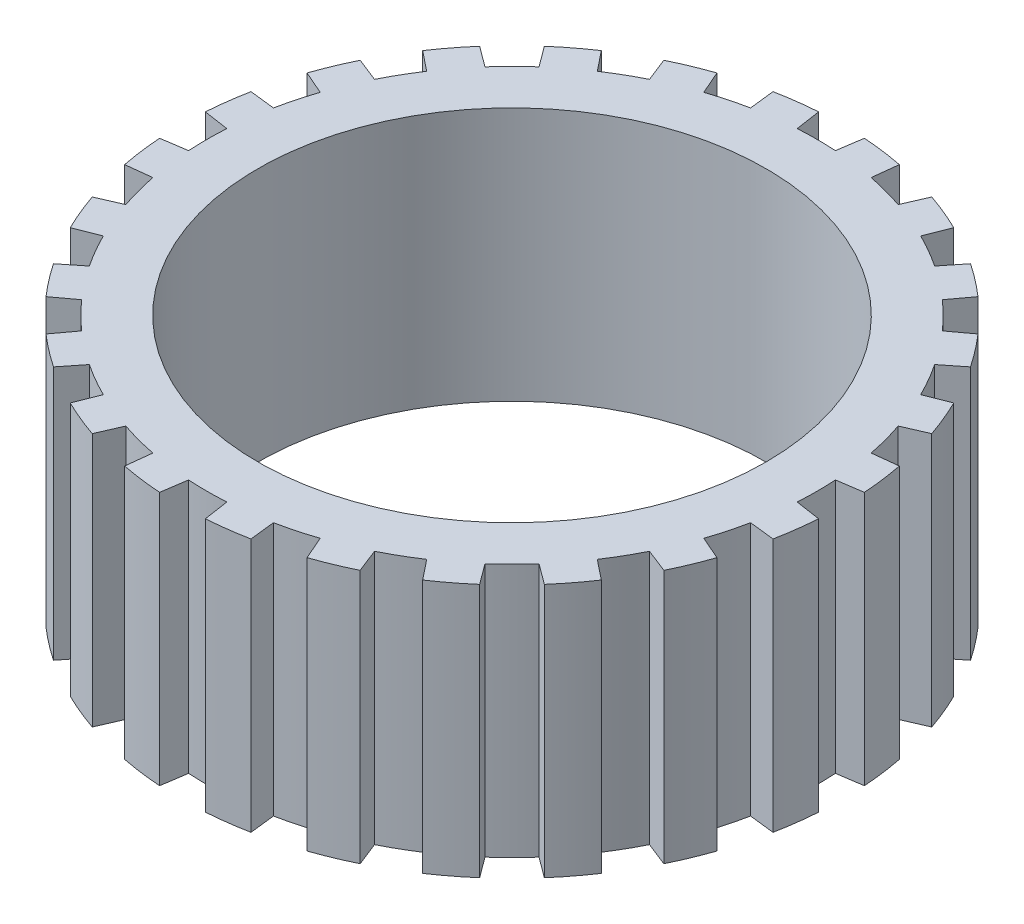
from build123d import *

# Parameters (mm, degrees)
SKETCH2_W           = 10
SKETCH2_H           = 50
BOSS_EXTRUDE1_START = 50
BOSS_EXTRUDE1_DEPTH = 50


with BuildPart() as part:
    # Sketch2 → Revolve1 (revolve)
    with BuildSketch(Plane.XY):
        with Locations((55, 25)):
            Rectangle(SKETCH2_W, SKETCH2_H)
    revolve(axis=Axis((0, -1000, 0), (0, 1, 0)))

    # Sketch3 → Boss-Extrude1 (add)
    with BuildSketch(Plane(origin=(0, 0, 0), x_dir=(1, 0, 0), z_dir=(0, 1, 0)).offset(BOSS_EXTRUDE1_START)):
        with BuildLine():
            Line((4.502343049, 64.84388103), (3.76078814, 59.88202128))
            ThreePointArc((3.76078814, 59.88202128), (7.831571533, 59.486691682), (11.865965175, 58.81495448))
            Line((11.865965175, 58.81495448), (12.43390194, 63.799671493))
            ThreePointArc((12.43390194, 63.799671493), (8.484202494, 64.443915989), (4.502343049, 64.84388103))
        make_face()
        with BuildLine():
            Line((21.131760798, 61.469087235), (19.131249958, 56.868227289))
            ThreePointArc((19.131249958, 56.868227289), (22.961005942, 55.432771951), (26.684072572, 53.739745728))
            Line((26.684072572, 53.739745728), (28.522797059, 58.407619777))
            ThreePointArc((28.522797059, 58.407619777), (24.874423104, 60.052169613), (21.131760798, 61.469087235))
        make_face()
        with BuildLine():
            Line((36.321083972, 53.905276728), (33.197948708, 49.978957588))
            ThreePointArc((33.197948708, 49.978957588), (36.525685741, 47.601200417), (39.683704522, 45.002262115))
            Line((39.683704522, 45.002262115), (42.667910694, 49.035185296))
            ThreePointArc((42.667910694, 49.035185296), (39.569492886, 51.567967119), (36.321083972, 53.905276728))
        make_face()
        with BuildLine():
            Line((49.035185296, 42.667910694), (45.002262115, 39.683704522))
            ThreePointArc((45.002262115, 39.683704522), (47.601200417, 36.525685741), (49.978957588, 33.197948708))
            Line((49.978957588, 33.197948708), (53.905276728, 36.321083972))
            ThreePointArc((53.905276728, 36.321083972), (51.567967119, 39.569492886), (49.035185296, 42.667910694))
        make_face()
        with BuildLine():
            Line((58.407619777, 28.522797059), (53.739745728, 26.684072572))
            ThreePointArc((53.739745728, 26.684072572), (55.432771951, 22.961005942), (56.868227289, 19.131249958))
            Line((56.868227289, 19.131249958), (61.469087235, 21.131760798))
            ThreePointArc((61.469087235, 21.131760798), (60.052169613, 24.874423104), (58.407619777, 28.522797059))
        make_face()
        with BuildLine():
            Line((63.799671493, 12.43390194), (58.81495448, 11.865965175))
            ThreePointArc((58.81495448, 11.865965175), (59.486691682, 7.831571533), (59.88202128, 3.76078814))
            Line((59.88202128, 3.76078814), (64.84388103, 4.502343049))
            ThreePointArc((64.84388103, 4.502343049), (64.443915989, 8.484202494), (63.799671493, 12.43390194))
        make_face()
        with BuildLine():
            Line((64.84388103, -4.502343049), (59.88202128, -3.76078814))
            ThreePointArc((59.88202128, -3.76078814), (59.486691682, -7.831571533), (58.81495448, -11.865965175))
            Line((58.81495448, -11.865965175), (63.799671493, -12.43390194))
            ThreePointArc((63.799671493, -12.43390194), (64.443915989, -8.484202494), (64.84388103, -4.502343049))
        make_face()
        with BuildLine():
            Line((61.469087235, -21.131760798), (56.868227289, -19.131249958))
            ThreePointArc((56.868227289, -19.131249958), (55.432771951, -22.961005942), (53.739745728, -26.684072572))
            Line((53.739745728, -26.684072572), (58.407619777, -28.522797059))
            ThreePointArc((58.407619777, -28.522797059), (60.052169613, -24.874423104), (61.469087235, -21.131760798))
        make_face()
        with BuildLine():
            Line((53.905276728, -36.321083972), (49.978957588, -33.197948708))
            ThreePointArc((49.978957588, -33.197948708), (47.601200417, -36.525685741), (45.002262115, -39.683704522))
            Line((45.002262115, -39.683704522), (49.035185296, -42.667910694))
            ThreePointArc((49.035185296, -42.667910694), (51.567967119, -39.569492886), (53.905276728, -36.321083972))
        make_face()
        with BuildLine():
            Line((42.667910694, -49.035185296), (39.683704522, -45.002262115))
            ThreePointArc((39.683704522, -45.002262115), (36.525685741, -47.601200417), (33.197948708, -49.978957588))
            Line((33.197948708, -49.978957588), (36.321083972, -53.905276728))
            ThreePointArc((36.321083972, -53.905276728), (39.569492886, -51.567967119), (42.667910694, -49.035185296))
        make_face()
        with BuildLine():
            Line((28.522797059, -58.407619777), (26.684072572, -53.739745728))
            ThreePointArc((26.684072572, -53.739745728), (22.961005942, -55.432771951), (19.131249958, -56.868227289))
            Line((19.131249958, -56.868227289), (21.131760798, -61.469087235))
            ThreePointArc((21.131760798, -61.469087235), (24.874423104, -60.052169613), (28.522797059, -58.407619777))
        make_face()
        with BuildLine():
            Line((12.43390194, -63.799671493), (11.865965175, -58.81495448))
            ThreePointArc((11.865965175, -58.81495448), (7.831571533, -59.486691682), (3.76078814, -59.88202128))
            Line((3.76078814, -59.88202128), (4.502343049, -64.84388103))
            ThreePointArc((4.502343049, -64.84388103), (8.484202494, -64.443915989), (12.43390194, -63.799671493))
        make_face()
        with BuildLine():
            Line((-4.502343049, -64.84388103), (-3.76078814, -59.88202128))
            ThreePointArc((-3.76078814, -59.88202128), (-7.831571533, -59.486691682), (-11.865965175, -58.81495448))
            Line((-11.865965175, -58.81495448), (-12.43390194, -63.799671493))
            ThreePointArc((-12.43390194, -63.799671493), (-8.484202494, -64.443915989), (-4.502343049, -64.84388103))
        make_face()
        with BuildLine():
            Line((-21.131760798, -61.469087235), (-19.131249958, -56.868227289))
            ThreePointArc((-19.131249958, -56.868227289), (-22.961005942, -55.432771951), (-26.684072572, -53.739745728))
            Line((-26.684072572, -53.739745728), (-28.522797059, -58.407619777))
            ThreePointArc((-28.522797059, -58.407619777), (-24.874423104, -60.052169613), (-21.131760798, -61.469087235))
        make_face()
        with BuildLine():
            Line((-36.321083972, -53.905276728), (-33.197948708, -49.978957588))
            ThreePointArc((-33.197948708, -49.978957588), (-36.525685741, -47.601200417), (-39.683704522, -45.002262115))
            Line((-39.683704522, -45.002262115), (-42.667910694, -49.035185296))
            ThreePointArc((-42.667910694, -49.035185296), (-39.569492886, -51.567967119), (-36.321083972, -53.905276728))
        make_face()
        with BuildLine():
            Line((-49.035185296, -42.667910694), (-45.002262115, -39.683704522))
            ThreePointArc((-45.002262115, -39.683704522), (-47.601200417, -36.525685741), (-49.978957588, -33.197948708))
            Line((-49.978957588, -33.197948708), (-53.905276728, -36.321083972))
            ThreePointArc((-53.905276728, -36.321083972), (-51.567967119, -39.569492886), (-49.035185296, -42.667910694))
        make_face()
        with BuildLine():
            Line((-58.407619777, -28.522797059), (-53.739745728, -26.684072572))
            ThreePointArc((-53.739745728, -26.684072572), (-55.432771951, -22.961005942), (-56.868227289, -19.131249958))
            Line((-56.868227289, -19.131249958), (-61.469087235, -21.131760798))
            ThreePointArc((-61.469087235, -21.131760798), (-60.052169613, -24.874423104), (-58.407619777, -28.522797059))
        make_face()
        with BuildLine():
            Line((-63.799671493, -12.43390194), (-58.81495448, -11.865965175))
            ThreePointArc((-58.81495448, -11.865965175), (-59.486691682, -7.831571533), (-59.88202128, -3.76078814))
            Line((-59.88202128, -3.76078814), (-64.84388103, -4.502343049))
            ThreePointArc((-64.84388103, -4.502343049), (-64.443915989, -8.484202494), (-63.799671493, -12.43390194))
        make_face()
        with BuildLine():
            Line((-64.84388103, 4.502343049), (-59.88202128, 3.76078814))
            ThreePointArc((-59.88202128, 3.76078814), (-59.486691682, 7.831571533), (-58.81495448, 11.865965175))
            Line((-58.81495448, 11.865965175), (-63.799671493, 12.43390194))
            ThreePointArc((-63.799671493, 12.43390194), (-64.443915989, 8.484202494), (-64.84388103, 4.502343049))
        make_face()
        with BuildLine():
            Line((-61.469087235, 21.131760798), (-56.868227289, 19.131249958))
            ThreePointArc((-56.868227289, 19.131249958), (-55.432771951, 22.961005942), (-53.739745728, 26.684072572))
            Line((-53.739745728, 26.684072572), (-58.407619777, 28.522797059))
            ThreePointArc((-58.407619777, 28.522797059), (-60.052169613, 24.874423104), (-61.469087235, 21.131760798))
        make_face()
        with BuildLine():
            Line((-53.905276728, 36.321083972), (-49.978957588, 33.197948708))
            ThreePointArc((-49.978957588, 33.197948708), (-47.601200417, 36.525685741), (-45.002262115, 39.683704522))
            Line((-45.002262115, 39.683704522), (-49.035185296, 42.667910694))
            ThreePointArc((-49.035185296, 42.667910694), (-51.567967119, 39.569492886), (-53.905276728, 36.321083972))
        make_face()
        with BuildLine():
            Line((-42.667910694, 49.035185296), (-39.683704522, 45.002262115))
            ThreePointArc((-39.683704522, 45.002262115), (-36.525685741, 47.601200417), (-33.197948708, 49.978957588))
            Line((-33.197948708, 49.978957588), (-36.321083972, 53.905276728))
            ThreePointArc((-36.321083972, 53.905276728), (-39.569492886, 51.567967119), (-42.667910694, 49.035185296))
        make_face()
        with BuildLine():
            Line((-28.522797059, 58.407619777), (-26.684072572, 53.739745728))
            ThreePointArc((-26.684072572, 53.739745728), (-22.961005942, 55.432771951), (-19.131249958, 56.868227289))
            Line((-19.131249958, 56.868227289), (-21.131760798, 61.469087235))
            ThreePointArc((-21.131760798, 61.469087235), (-24.874423104, 60.052169613), (-28.522797059, 58.407619777))
        make_face()
        with BuildLine():
            Line((-12.43390194, 63.799671493), (-11.865965175, 58.81495448))
            ThreePointArc((-11.865965175, 58.81495448), (-7.831571533, 59.486691682), (-3.76078814, 59.88202128))
            Line((-3.76078814, 59.88202128), (-4.502343049, 64.84388103))
            ThreePointArc((-4.502343049, 64.84388103), (-8.484202494, 64.443915989), (-12.43390194, 63.799671493))
        make_face()
    extrude(amount=-BOSS_EXTRUDE1_DEPTH)


solid = part.part
